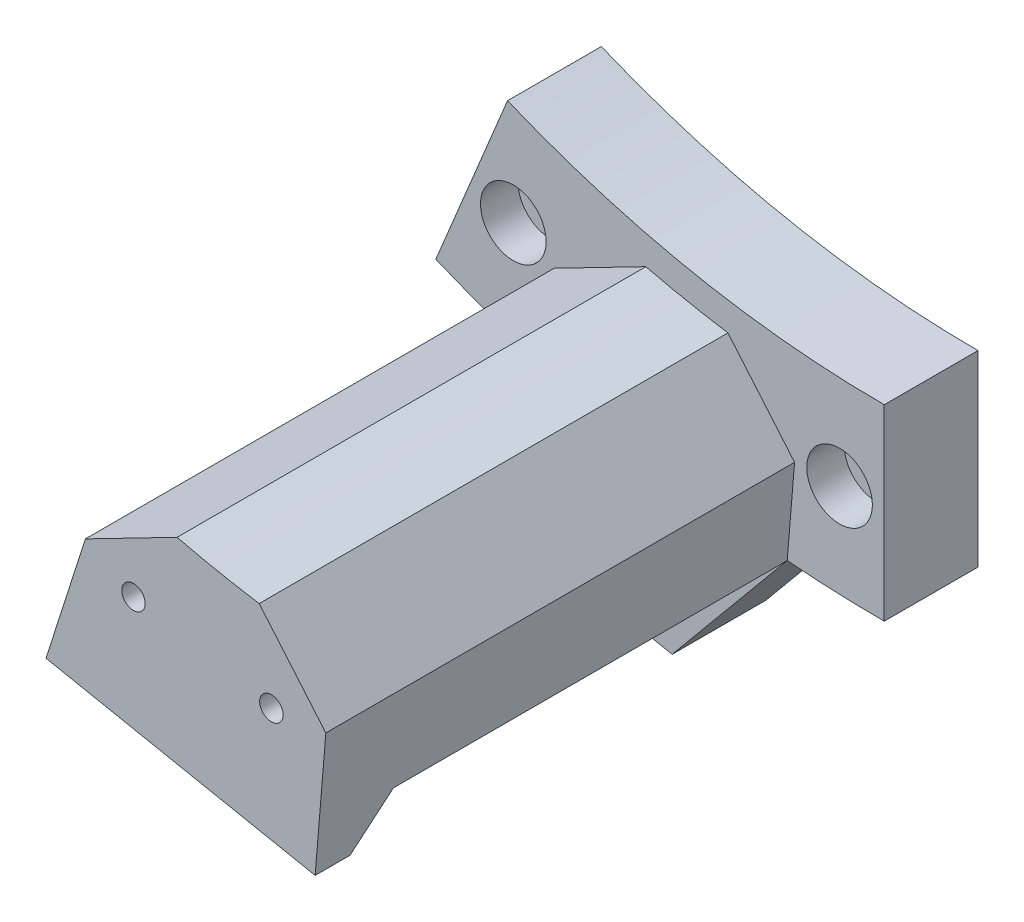
from build123d import *

# Parameters (mm, degrees)
BOSS_EXTRU_1_DEPTH      = 10
BOSS_EXTRU_2_DEPTH      = 48
BOSS_EXTRU_3_DEPTH      = 2
CHANFREIN1_SIZE         = 6
ENL_V_MAT_EXTRU_1_REACH = 148.244
ESQUISSE5_R             = 1.75
ESQUISSE6_R             = 3.5
ENL_V_MAT_EXTRU_2_DEPTH = 4
CHANFREIN2_SIZE         = 7.5
ESQUISSE7_R             = 1.25
ENL_V_MAT_EXTRU_3_DEPTH = 10
BOSS_EXTRU_4_DEPTH      = 10
ESQUISSE9_R             = 2.75
ENL_V_MAT_EXTRU_4_DEPTH = 2


with BuildPart() as part:
    # Esquisse1 → Boss.-Extru.1 (new body)
    with BuildSketch(Plane.XY):
        with BuildLine():
            Line((-40.181760398, -97.007350914), (-47.835429046, -115.484941564))
            ThreePointArc((-47.835429046, -115.484941564), (-24.386290252, -122.59816005), (0, -125))
            Line((0, -125), (0, -105))
            ThreePointArc((0, -105), (-20.484483812, -102.982454442), (-40.181760398, -97.007350914))
        make_face()
    extrude(amount=BOSS_EXTRU_1_DEPTH)

    # Esquisse2 → Boss.-Extru.2 (add)
    with BuildSketch(Plane.XY.offset(10)):
        with BuildLine():
            Line((-32.925344295, -102.858746361), (-38.108037379, -119.049474955))
            ThreePointArc((-38.108037379, -119.049474955), (-24.386290252, -122.59816005), (-10.351025939, -124.570687812))
            Line((-10.351025939, -124.570687812), (-8.943286411, -107.62907427))
            ThreePointArc((-8.943286411, -107.62907427), (-21.069754778, -105.924810284), (-32.925344295, -102.858746361))
        make_face()
    extrude(amount=BOSS_EXTRU_2_DEPTH)

    # Esquisse4 → Boss.-Extru.3 (add)
    with BuildSketch(Plane.XY.offset(58)):
        with BuildLine():
            Line((-39.413172773, -123.12671677), (-10.705530953, -128.837021766))
            Line((-10.705530953, -128.837021766), (-8.943286411, -107.62907427))
            ThreePointArc((-8.943286411, -107.62907427), (-21.069754778, -105.924810284), (-32.925344295, -102.858746361))
            Line((-32.925344295, -102.858746361), (-39.413172773, -123.12671677))
        make_face()
    extrude(amount=BOSS_EXTRU_3_DEPTH)

    # Chanfrein1
    # the kernel refuses this chamfer: 6 mm, written as the material it adds along each edge
    with BuildSketch(Plane(origin=(0, 0, 58), x_dir=(-0.3048642990280114, -0.9523957996432781, 0), z_dir=(-0.9523957996432781, 0.3048642990280114, 0))) as chanfrein1_piece_1_section:
        Polygon((125 + CHANFREIN1_SIZE, 0), (125, -CHANFREIN1_SIZE), (125, 0), align=None)
    chanfrein1_piece_1 = revolve(axis=Axis((0, 0, 58), (0, 0, 1)), revolution_arc=13, mode=Mode.PRIVATE)
    chanfrein1_piece_1 = split(chanfrein1_piece_1, bisect_by=Plane(origin=(-25.059351863, -125.981869268, 58), z_dir=(0.19509032201612828, 0.9807852804032304, 0)), keep=Keep.TOP, mode=Mode.PRIVATE)
    add(chanfrein1_piece_1)

    # Esquisse5 → Enlèv. mat.-Extru.1 (cut, up to next)
    with BuildSketch(Plane.XY.offset(10), mode=Mode.PRIVATE) as enl_v_mat_extru_1_sk1:
        with Locations((-4.765565521, -114.901215769)):
            Circle(ESQUISSE5_R)
    enl_v_mat_extru_1_tool1 = extrude(enl_v_mat_extru_1_sk1.sketch, amount=-ENL_V_MAT_EXTRU_1_REACH, mode=Mode.PRIVATE) & part.part
    # Esquisse5 → Enlèv. mat.-Extru.1 (cut, up to next)
    with BuildSketch(Plane.XY.offset(10), mode=Mode.PRIVATE) as enl_v_mat_extru_1_sk2:
        with Locations((-39.567983188, -107.978584481)):
            Circle(ESQUISSE5_R)
    enl_v_mat_extru_1_tool2 = extrude(enl_v_mat_extru_1_sk2.sketch, amount=-ENL_V_MAT_EXTRU_1_REACH, mode=Mode.PRIVATE) & part.part
    add(enl_v_mat_extru_1_tool1.solids().sort_by_distance((-4.765566, -114.901216, 10))[0], mode=Mode.SUBTRACT)
    add(enl_v_mat_extru_1_tool2.solids().sort_by_distance((-39.567983, -107.978584, 10))[0], mode=Mode.SUBTRACT)

    # Esquisse6 → Enlèv. mat.-Extru.2 (cut)
    with BuildSketch(Plane.XY.offset(10)):
        with Locations((-39.567983188, -107.978584481)):
            Circle(ESQUISSE6_R)
        with Locations((-4.765565521, -114.901215769)):
            Circle(ESQUISSE6_R)
    extrude(amount=-ENL_V_MAT_EXTRU_2_DEPTH, mode=Mode.SUBTRACT)

    # Chanfrein2
    # the kernel refuses this chamfer: 7.5 mm, written as the material it takes off along each edge
    with BuildSketch(Plane(origin=(-8.943286411, -107.62907427, 10), x_dir=(-0.08280820751335238, -0.996565502497666, 0), z_dir=(0, 0, 1)), Plane(origin=(-32.925344295, -102.858746361, 80.019854797), x_dir=(-0.3048642990290983, -0.9523957996429303, 0), z_dir=(0, 0, -1))) as chanfrein2_piece_1:
        with BuildLine():
            Line((CHANFREIN2_SIZE, 0), (-0.280634385, -7.780634385))
            ThreePointArc((-0.280634385, -7.780634385), (-0.074202159, -4.002769088), (0, 0))
            Line((0, 0), (CHANFREIN2_SIZE, 0))
        make_face()
    extrude(amount=70.019854797, mode=Mode.SUBTRACT)

    # Esquisse7 → Enlèv. mat.-Extru.3 (cut)
    with BuildSketch(Plane.XY.offset(60)):
        with Locations((-30.083912118, -112.798307752)):
            Circle(ESQUISSE7_R)
        with Locations((-15.372132912, -115.724662582)):
            Circle(ESQUISSE7_R)
    extrude(amount=-ENL_V_MAT_EXTRU_3_DEPTH, mode=Mode.SUBTRACT)

    # Esquisse8 → Boss.-Extru.4 (add)
    with BuildSketch(Plane(origin=(0, 0, 0), x_dir=(-1, 0, 0), z_dir=(0, 0, -1))):
        with BuildLine():
            Line((22.625550905, -139.375480075), (32.433403709, -137.424576855))
            Line((32.433403709, -137.424576855), (38.108037379, -119.049474955))
            ThreePointArc((38.108037379, -119.049474955), (24.386290252, -122.59816005), (10.351025939, -124.570687812))
            Line((10.351025939, -124.570687812), (22.625550905, -139.375480075))
        make_face()
    extrude(amount=-BOSS_EXTRU_4_DEPTH)

    # Esquisse9 → Enlèv. mat.-Extru.4 (cut)
    with BuildSketch(Plane(origin=(-27.529477307, -138.400028465, 0), x_dir=(0.9807852804032304, -0.19509032201612822, 0), z_dir=(-0.19509032201612822, -0.9807852804032304, 0))):
        with Locations((0, 5)):
            Circle(ESQUISSE9_R)
    extrude(amount=-ENL_V_MAT_EXTRU_4_DEPTH, mode=Mode.SUBTRACT)


solid = part.part
